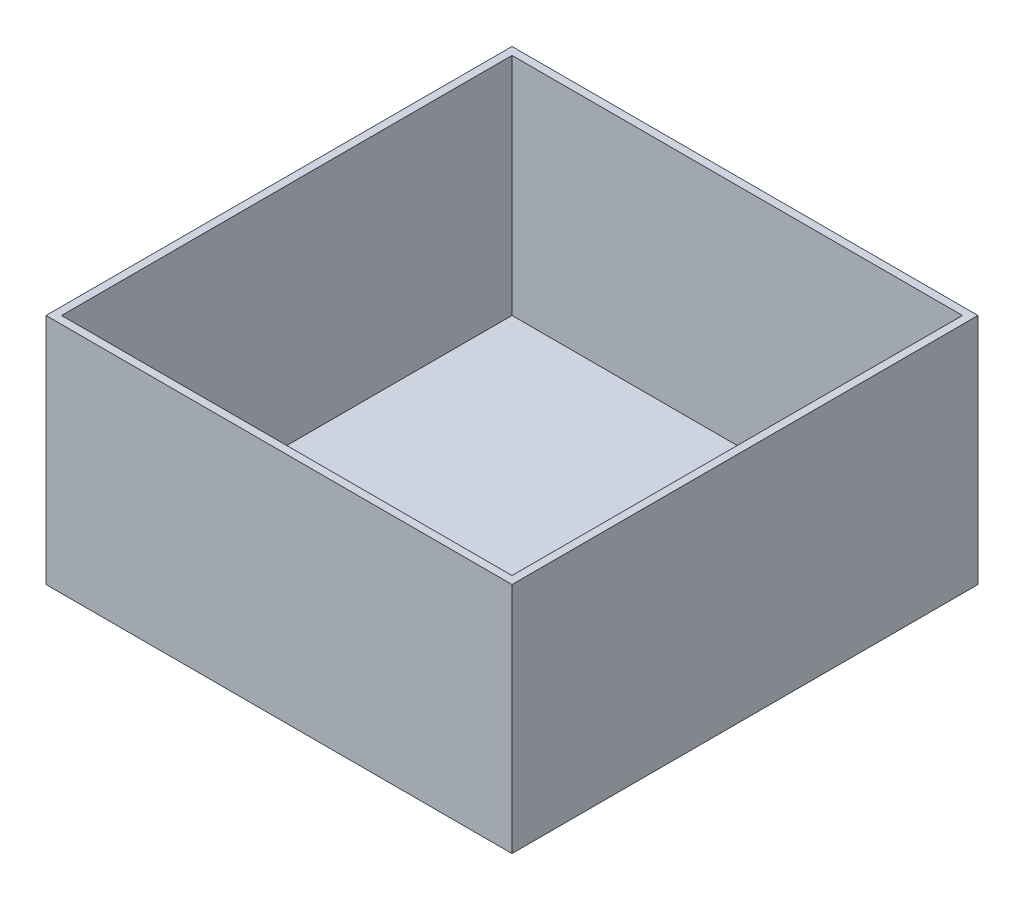
from build123d import *

# Parameters (mm, degrees)
SKETCH1_W           = 120
SKETCH1_H           = 120
BOSS_EXTRUDE1_DEPTH = 60
SHELL1_T            = -2


with BuildPart() as part:
    # Sketch1 → Boss-Extrude1 (new body)
    with BuildSketch(Plane(origin=(0, 0, 0), x_dir=(1, 0, 0), z_dir=(0, 1, 0))):
        Rectangle(SKETCH1_W, SKETCH1_H)
    extrude(amount=BOSS_EXTRUDE1_DEPTH)

    # Shell1
    shell1_openings = [part.faces().sort_by_distance(p)[0] for p in [
        (0, 60, 0),
    ]]
    offset(amount=SHELL1_T, openings=shell1_openings, kind=Kind.INTERSECTION)


solid = part.part
